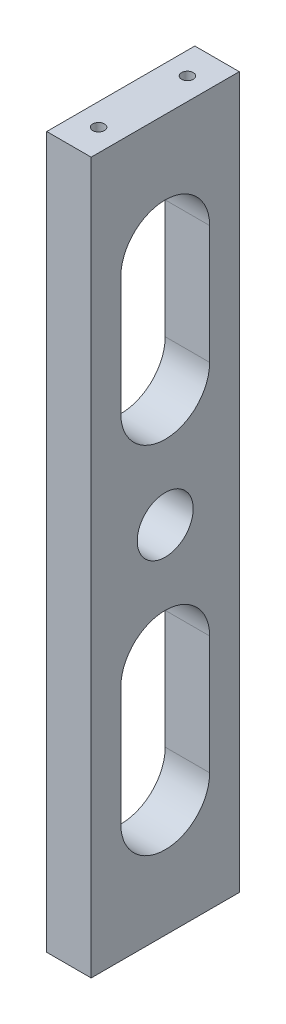
from build123d import *

# Parameters (mm, degrees)
SKETCH1_W                      = 31.75
SKETCH1_H                      = 152.4
BOSS_EXTRUDE1_DEPTH            = 4.7625
M3X0_5_TAPPED_HOLE1_AT_2_COUNT = 2
M3X0_5_TAPPED_HOLE1_AT_2_PITCH = 19.05
F_12_0MM_DOWEL_HOLE1_D         = 12
CUT_EXTRUDE1_DEPTH             = 79.416715374


with BuildPart() as part:
    # Sketch1 → Boss-Extrude1 (new, symmetric)
    with BuildSketch(Plane(origin=(0, 0, 0), x_dir=(0, 0, -1), z_dir=(1, 0, 0))):
        Rectangle(SKETCH1_W, SKETCH1_H)
    extrude(amount=BOSS_EXTRUDE1_DEPTH, both=True)

    # Sketch4 → M3x0.5 Tapped Hole1 (revolve, cut)
    with BuildSketch(Plane(origin=(0, 76.2, -9.525), x_dir=(0, 0, 1), z_dir=(1, 0, 0))):
        Polygon((0, 0), (0, 13.451075774), (1.25, 12.7), (1.25, 0), align=None)
    m3x0_5_tapped_hole1 = revolve(axis=Axis((0, 82.55, -9.525), (0, -1, 0)), mode=Mode.SUBTRACT)

    # M3x0.5 Tapped Hole1 at 2: M3x0.5 Tapped Hole1 ×2
    with Locations(*[(0, 0, i * M3X0_5_TAPPED_HOLE1_AT_2_PITCH) for i in range(1, M3X0_5_TAPPED_HOLE1_AT_2_COUNT)]):
        add(m3x0_5_tapped_hole1, mode=Mode.SUBTRACT)

    # Mirror1: M3x0.5 Tapped Hole1 across plane
    add(m3x0_5_tapped_hole1.mirror(Plane.ZX), mode=Mode.SUBTRACT)

    # Mirror1 copy 1 sketch → Mirror1 copy 1 (revolve, cut)
    with BuildSketch(Plane(origin=(0, -76.2, 9.525), x_dir=(0, 0, 1), z_dir=(1, 0, 0))):
        Polygon((0, 0), (0, -13.451075774), (1.25, -12.7), (1.25, 0), align=None)
    revolve(axis=Axis((0, -82.55, 9.525), (0, -1, 0)), mode=Mode.SUBTRACT)

    # Ø12.0mm Dowel Hole1 (through all)
    with Locations(Plane(origin=(4.7625, 0, 0), x_dir=(0, 0, -1), z_dir=(1, 0, 0))):
        with Locations((0, 0)):
            Hole(F_12_0MM_DOWEL_HOLE1_D / 2)

    # Sketch9 → Cut-Extrude1 (cut, through all)
    with BuildSketch(Plane(origin=(4.7625, 0, 0), x_dir=(0, 0, -1), z_dir=(1, 0, 0))):
        with BuildLine():
            ThreePointArc((9.525, -25.4), (6.735192091, -18.664807909), (0, -15.875))
            ThreePointArc((0, -15.875), (-6.735192091, -18.664807909), (-9.525, -25.4))
            Line((-9.525, -25.4), (-9.525, -50.8))
            ThreePointArc((-9.525, -50.8), (0, -60.325), (9.525, -50.8))
            Line((9.525, -50.8), (9.525, -25.4))
        make_face()
        with BuildLine():
            Line((9.525, 25.4), (9.525, 50.8))
            ThreePointArc((9.525, 50.8), (0, 60.325), (-9.525, 50.8))
            Line((-9.525, 50.8), (-9.525, 25.4))
            ThreePointArc((-9.525, 25.4), (-6.735192091, 18.664807909), (0, 15.875))
            ThreePointArc((0, 15.875), (6.735192091, 18.664807909), (9.525, 25.4))
        make_face()
    extrude(amount=-CUT_EXTRUDE1_DEPTH, mode=Mode.SUBTRACT)


solid = part.part
